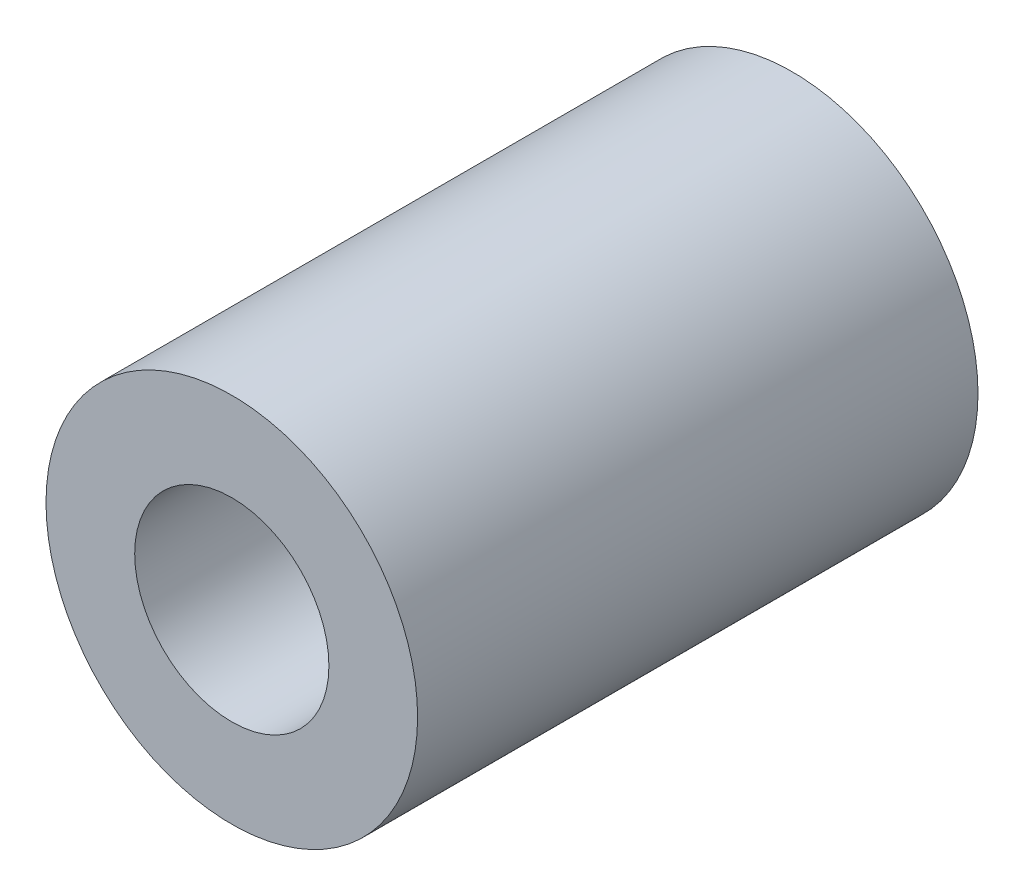
from build123d import *

# Parameters (mm, degrees)
SKETCH1_R           = 4.7625
SKETCH1_R_2         = 2.4892
BOSS_EXTRUDE1_DEPTH = 7.18185


with BuildPart() as part:
    # Sketch1 → Boss-Extrude1 (new, symmetric)
    with BuildSketch(Plane.XY):
        Circle(SKETCH1_R)
        Circle(SKETCH1_R_2, mode=Mode.SUBTRACT)
    extrude(amount=BOSS_EXTRUDE1_DEPTH, both=True)


solid = part.part
